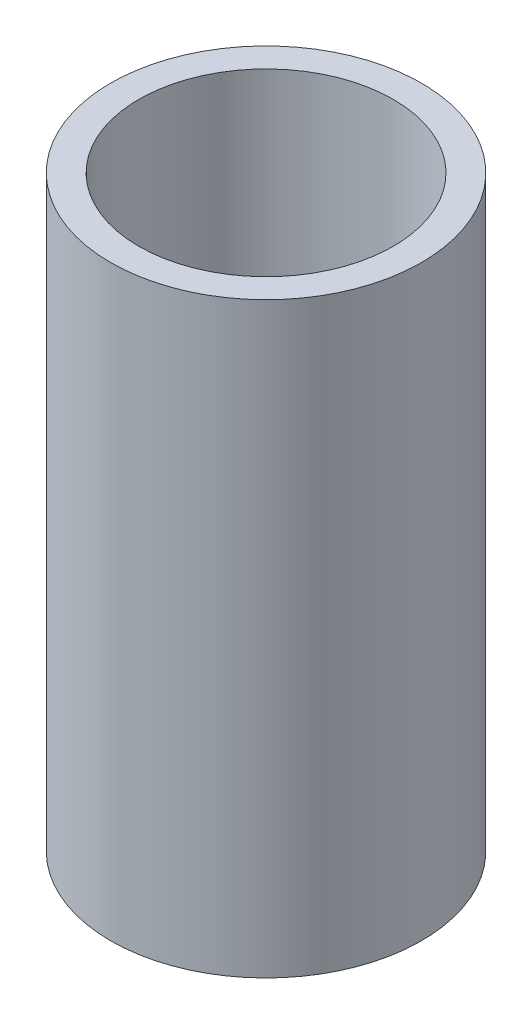
from build123d import *

# Parameters (mm, degrees)
SKETCH1_R           = 15.875
SKETCH1_R_2         = 13
BOSS_EXTRUDE1_DEPTH = 60


with BuildPart() as part:
    # Sketch1 → Boss-Extrude1 (new body)
    with BuildSketch(Plane(origin=(0, 0, 0), x_dir=(1, 0, 0), z_dir=(0, 1, 0))):
        Circle(SKETCH1_R)
        Circle(SKETCH1_R_2, mode=Mode.SUBTRACT)
    extrude(amount=BOSS_EXTRUDE1_DEPTH)


solid = part.part
